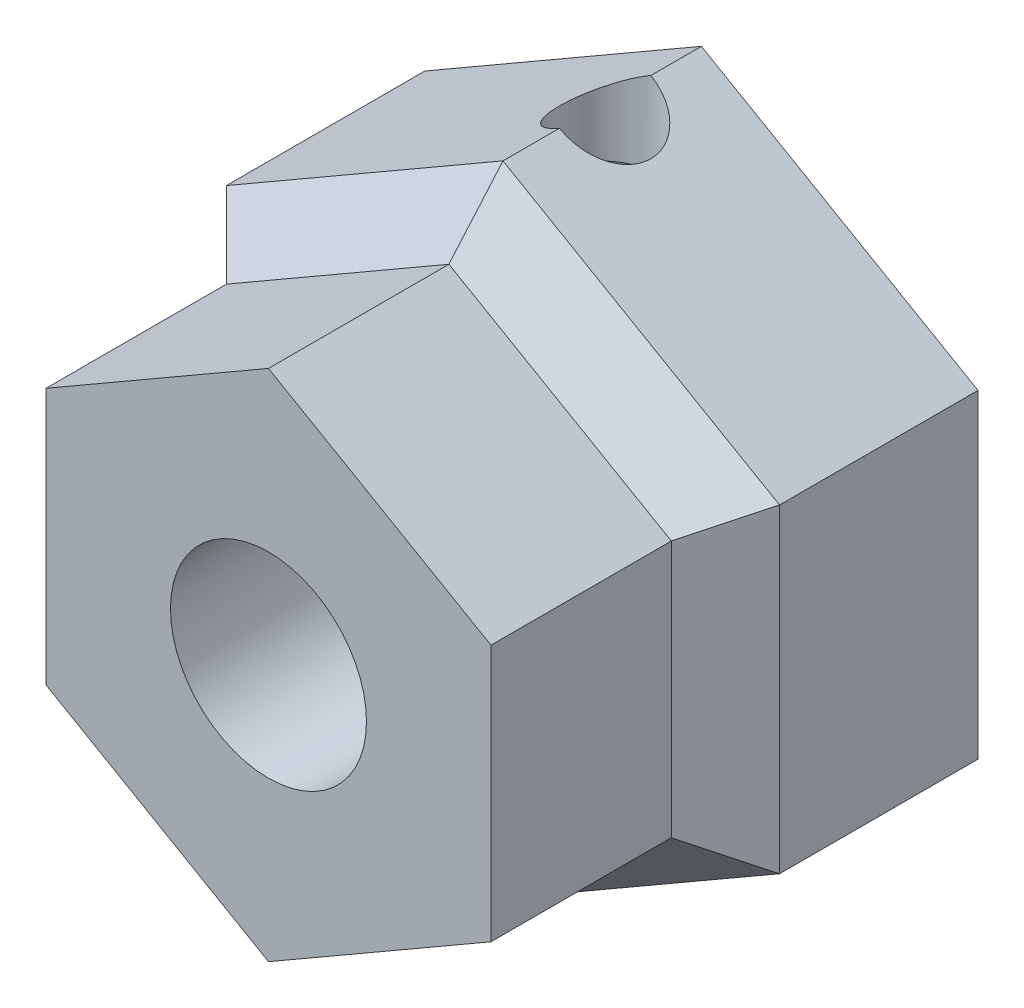
from build123d import *
from build123d.topology import SkipClean

# Parameters (mm, degrees)
SKETCH2_R           = 4.075
BOSS_EXTRUDE2_DEPTH = 8
SKETCH18_R          = 4.075
BOSS_EXTRUDE4_DEPTH = 10
SKETCH5_R           = 1.9
CUT_EXTRUDE8_DEPTH  = 26.151209381
CUT_EXTRUDE7_DEPTH  = 2.8
CIRPATTERN1_COUNT   = 2
CIRPATTERN1_ANGLE   = 90
BOSS_EXTRUDE3_START = 2.5
SKETCH17_R          = 5.575
SKETCH17_R_2        = 4.075
BOSS_EXTRUDE3_DEPTH = 2.5
CHAMFER4_SIZE       = 2.5


with BuildPart() as part:
    # Sketch2 → Boss-Extrude2 (new body)
    with BuildSketch(Plane.XY):
        Polygon((11.5, -6.639528096), (11.5, 6.639528096), (0, 13.279056191), (-11.5, 6.639528096), (-11.5, -6.639528096), (0, -13.279056191), align=None)
        Circle(SKETCH2_R, mode=Mode.SUBTRACT)
    extrude(amount=BOSS_EXTRUDE2_DEPTH)

    # Sketch18 → Boss-Extrude4 (add)
    with BuildSketch(Plane(origin=(0, 0, 8), x_dir=(-1, 0, 0), z_dir=(0, 0, -1))):
        Polygon((-9.25, -5.34048999), (0, -10.68097998), (9.25, -5.34048999), (9.25, 5.34048999), (0, 10.68097998), (-9.25, 5.34048999), align=None)
        with Locations(Location((0, 0, 0), (0, 0, 180))):
            Circle(SKETCH18_R, mode=Mode.SUBTRACT)
    extrude(amount=-BOSS_EXTRUDE4_DEPTH)

    # Sketch5 → Cut-Extrude8 (cut, through all)
    with BuildSketch(Plane(origin=(0, 0, 0), x_dir=(0, 0, -1), z_dir=(0, -1, 0))):
        with Locations((-4, 0)):
            Circle(SKETCH5_R)
    cut_extrude8 = extrude(amount=-CUT_EXTRUDE8_DEPTH, mode=Mode.SUBTRACT)

    # Sketch16 → Cut-Extrude7 (cut)
    with BuildSketch(Plane(origin=(0, 7, 0), x_dir=(1, 0, 0), z_dir=(0, 1, 0))):
        Polygon((0, -7.290896534), (2.85, -5.645448267), (2.85, -2.354551733), (2.85, 0), (-2.85, 0), (-2.85, -2.354551733), (-2.85, -5.645448267), align=None)
    cut_extrude7 = extrude(amount=CUT_EXTRUDE7_DEPTH, mode=Mode.SUBTRACT)

    # CirPattern1: Cut-Extrude8, Cut-Extrude7 ×2 about axis
    cirpattern1_axis = Axis((0, 0, 0), (0, 0, 1))
    add([cut_extrude8.rotate(cirpattern1_axis, i * CIRPATTERN1_ANGLE / (CIRPATTERN1_COUNT - 1)) for i in range(1, CIRPATTERN1_COUNT)], mode=Mode.SUBTRACT)
    add([cut_extrude7.rotate(cirpattern1_axis, i * CIRPATTERN1_ANGLE / (CIRPATTERN1_COUNT - 1)) for i in range(1, CIRPATTERN1_COUNT)], mode=Mode.SUBTRACT)

    # Sketch17 → Boss-Extrude3 (add)
    with SkipClean():  # the faces are left unmerged after this step: merging them gives an invalid solid
        with BuildSketch(Plane(origin=(0, 0, 0), x_dir=(-1, 0, 0), z_dir=(0, 0, -1)).offset(BOSS_EXTRUDE3_START)):
            with Locations(Location((0, 0, 0), (0, 0, 180))):
                Circle(SKETCH17_R)
            Circle(SKETCH17_R_2, mode=Mode.SUBTRACT)
        extrude(amount=-BOSS_EXTRUDE3_DEPTH)

    # Chamfer4
    # the kernel refuses this chamfer: 2.5 mm, written as the material it adds along each edge
    with BuildSketch(Plane(origin=(14.817856995, -2.125886255, 8), x_dir=(0.49981095845564855, -0.8656979742248802, -0.0274958766105863), z_dir=(-0.8660254037844386, -0.5000000000000002, 0))) as chamfer4_piece_1_section:
        Polygon((CHAMFER4_SIZE * 0.999621916911, CHAMFER4_SIZE * 0.0274958766106), (-CHAMFER4_SIZE * 0.0274958766106, CHAMFER4_SIZE * 0.999621916911), (0, 0), align=None)
    chamfer4_piece_1 = extrude(amount=23.53939492, mode=Mode.PRIVATE)
    chamfer4_piece_1 = split(chamfer4_piece_1, bisect_by=Plane(origin=(5.75, -9.959292144, 8.862467682), z_dir=(-0.5000000000000001, 0.8660254037844386, 0)), keep=Keep.TOP, mode=Mode.PRIVATE)
    chamfer4_piece_1 = split(chamfer4_piece_1, bisect_by=Plane(origin=(9.25, -8.662876539, 8.862467682), z_dir=(-1, 0, 0)), keep=Keep.TOP, mode=Mode.PRIVATE)
    chamfer4_piece_1 = split(chamfer4_piece_1, bisect_by=Plane(origin=(2.877271152, -12.342173254, 8.862467682), z_dir=(0.5000000000000001, 0.8660254037844387, 0)), keep=Keep.TOP, mode=Mode.PRIVATE)
    add(chamfer4_piece_1)
    with BuildSketch(Plane(origin=(5.567856995, -13.895583715, 8), x_dir=(-0.4998109584556484, -0.8656979742248803, -0.027495876610586313), z_dir=(-0.8660254037844387, 0.5000000000000001, 0))) as chamfer4_piece_2_section:
        Polygon((CHAMFER4_SIZE * 0.999621916911, CHAMFER4_SIZE * 0.0274958766106), (-CHAMFER4_SIZE * 0.0274958766106, CHAMFER4_SIZE * 0.999621916911), (0, 0), align=None)
    chamfer4_piece_2 = extrude(amount=23.53939492, mode=Mode.PRIVATE)
    chamfer4_piece_2 = split(chamfer4_piece_2, bisect_by=Plane(origin=(-5.75, -9.959292144, 8.862467682), z_dir=(0.5000000000000002, 0.8660254037844386, 0)), keep=Keep.TOP, mode=Mode.PRIVATE)
    chamfer4_piece_2 = split(chamfer4_piece_2, bisect_by=Plane(origin=(-9.25, -8.662876539, 8.862467682), z_dir=(1, 0, 0)), keep=Keep.TOP, mode=Mode.PRIVATE)
    chamfer4_piece_2 = split(chamfer4_piece_2, bisect_by=Plane(origin=(-2.877271152, -12.342173254, 8.862467682), z_dir=(-0.5000000000000002, 0.8660254037844386, 0)), keep=Keep.TOP, mode=Mode.PRIVATE)
    add(chamfer4_piece_2)
    with BuildSketch(Plane(origin=(-9.25, -11.76969746, 8), x_dir=(-0.9996219169112968, 0, -0.027495876610586317), z_dir=(0, 1, 0))) as chamfer4_piece_3_section:
        Polygon((CHAMFER4_SIZE * 0.999621916911, CHAMFER4_SIZE * 0.0274958766106), (-CHAMFER4_SIZE * 0.0274958766106, CHAMFER4_SIZE * 0.999621916911), (0, 0), align=None)
    chamfer4_piece_3 = extrude(amount=23.53939492, mode=Mode.PRIVATE)
    chamfer4_piece_3 = split(chamfer4_piece_3, bisect_by=Plane(origin=(-11.5, 0, 8.862467682), z_dir=(1, 0, 0)), keep=Keep.TOP, mode=Mode.PRIVATE)
    chamfer4_piece_3 = split(chamfer4_piece_3, bisect_by=Plane(origin=(-12.127271152, 3.679296716, 8.862467682), z_dir=(0.5, -0.8660254037844387, 0)), keep=Keep.TOP, mode=Mode.PRIVATE)
    chamfer4_piece_3 = split(chamfer4_piece_3, bisect_by=Plane(origin=(-12.127271152, -3.679296716, 8.862467682), z_dir=(0.5000000000000001, 0.8660254037844387, 0)), keep=Keep.TOP, mode=Mode.PRIVATE)
    add(chamfer4_piece_3)
    with BuildSketch(Plane(origin=(-14.817856995, 2.125886255, 8), x_dir=(-0.49981095845564827, 0.8656979742248804, -0.027495876610586303), z_dir=(0.8660254037844387, 0.5, 0))) as chamfer4_piece_4_section:
        Polygon((CHAMFER4_SIZE * 0.999621916911, CHAMFER4_SIZE * 0.0274958766106), (-CHAMFER4_SIZE * 0.0274958766106, CHAMFER4_SIZE * 0.999621916911), (0, 0), align=None)
    chamfer4_piece_4 = extrude(amount=23.53939492, mode=Mode.PRIVATE)
    chamfer4_piece_4 = split(chamfer4_piece_4, bisect_by=Plane(origin=(-5.75, 9.959292144, 8.862467682), z_dir=(0.49999999999999983, -0.8660254037844388, 0)), keep=Keep.TOP, mode=Mode.PRIVATE)
    chamfer4_piece_4 = split(chamfer4_piece_4, bisect_by=Plane(origin=(-2.877271152, 12.342173254, 8.862467682), z_dir=(-0.5, -0.8660254037844387, 0)), keep=Keep.TOP, mode=Mode.PRIVATE)
    chamfer4_piece_4 = split(chamfer4_piece_4, bisect_by=Plane(origin=(-9.25, 8.662876539, 8.862467682), z_dir=(1, 0, 0)), keep=Keep.TOP, mode=Mode.PRIVATE)
    add(chamfer4_piece_4)
    with BuildSketch(Plane(origin=(-5.567856995, 13.895583715, 8), x_dir=(0.4998109584556484, 0.8656979742248804, -0.027495876610586317), z_dir=(0.8660254037844387, -0.5, 0))) as chamfer4_piece_5_section:
        Polygon((CHAMFER4_SIZE * 0.999621916911, CHAMFER4_SIZE * 0.0274958766106), (-CHAMFER4_SIZE * 0.0274958766106, CHAMFER4_SIZE * 0.999621916911), (0, 0), align=None)
    chamfer4_piece_5 = extrude(amount=23.53939492, mode=Mode.PRIVATE)
    chamfer4_piece_5 = split(chamfer4_piece_5, bisect_by=Plane(origin=(5.75, 9.959292144, 8.862467682), z_dir=(-0.49999999999999983, -0.8660254037844388, 0)), keep=Keep.TOP, mode=Mode.PRIVATE)
    chamfer4_piece_5 = split(chamfer4_piece_5, bisect_by=Plane(origin=(9.25, 8.662876539, 8.862467682), z_dir=(-1, 0, 0)), keep=Keep.TOP, mode=Mode.PRIVATE)
    chamfer4_piece_5 = split(chamfer4_piece_5, bisect_by=Plane(origin=(2.877271152, 12.342173254, 8.862467682), z_dir=(0.5, -0.8660254037844387, 0)), keep=Keep.TOP, mode=Mode.PRIVATE)
    add(chamfer4_piece_5)
    with BuildSketch(Plane(origin=(9.25, 11.76969746, 8), x_dir=(0.9996219169112968, 0, -0.027495876610586317), z_dir=(0, -1, 0))) as chamfer4_piece_6_section:
        Polygon((CHAMFER4_SIZE * 0.999621916911, CHAMFER4_SIZE * 0.0274958766106), (-CHAMFER4_SIZE * 0.0274958766106, CHAMFER4_SIZE * 0.999621916911), (0, 0), align=None)
    chamfer4_piece_6 = extrude(amount=23.53939492, mode=Mode.PRIVATE)
    chamfer4_piece_6 = split(chamfer4_piece_6, bisect_by=Plane(origin=(11.5, 0, 8.862467682), z_dir=(-1, 0, 0)), keep=Keep.TOP, mode=Mode.PRIVATE)
    chamfer4_piece_6 = split(chamfer4_piece_6, bisect_by=Plane(origin=(12.127271152, 3.679296716, 8.862467682), z_dir=(-0.5, -0.8660254037844387, 0)), keep=Keep.TOP, mode=Mode.PRIVATE)
    chamfer4_piece_6 = split(chamfer4_piece_6, bisect_by=Plane(origin=(12.127271152, -3.679296716, 8.862467682), z_dir=(-0.5000000000000002, 0.8660254037844386, 0)), keep=Keep.TOP, mode=Mode.PRIVATE)
    add(chamfer4_piece_6)
    with BuildSketch(Plane(origin=(9.25, 11.76969746, 8), x_dir=(0.9996219169112968, 0, -0.027495876610586317), z_dir=(0, -1, 0))) as chamfer4_piece_7a_section:
        Polygon((CHAMFER4_SIZE * 0.999621916911, CHAMFER4_SIZE * 0.0274958766106), (-CHAMFER4_SIZE * 0.0274958766106, CHAMFER4_SIZE * 0.999621916911), (0, 0), align=None)
    chamfer4_piece_7a = extrude(amount=23.53939492, mode=Mode.PRIVATE)
    chamfer4_piece_7a = split(chamfer4_piece_7a, bisect_by=Plane(origin=(11.5, -6.180288519, 8.839751868), z_dir=(-1, 0, 0)), keep=Keep.TOP, mode=Mode.PRIVATE)
    chamfer4_piece_7a = split(chamfer4_piece_7a, bisect_by=Plane(origin=(10.60792628, -7.154567098, 8.839751868), z_dir=(-0.5000000000000001, 0.8660254037844386, 0)), keep=Keep.TOP, mode=Mode.PRIVATE)
    chamfer4_piece_7a = split(chamfer4_piece_7a, bisect_by=Plane(origin=(9.48292628, -5.20600994, 8.839751868), z_dir=(0.5000000000000002, -0.8660254037844386, 0)), keep=Keep.TOP, mode=Mode.PRIVATE)
    with BuildSketch(Plane(origin=(14.817856995, -2.125886255, 8), x_dir=(0.49981095845564855, -0.8656979742248802, -0.0274958766105863), z_dir=(-0.8660254037844386, -0.5000000000000002, 0))) as chamfer4_piece_7b_section:
        Polygon((CHAMFER4_SIZE * 0.999621916911, CHAMFER4_SIZE * 0.0274958766106), (-CHAMFER4_SIZE * 0.0274958766106, CHAMFER4_SIZE * 0.999621916911), (0, 0), align=None)
    chamfer4_piece_7b = extrude(amount=23.53939492, mode=Mode.PRIVATE)
    chamfer4_piece_7b = split(chamfer4_piece_7b, bisect_by=Plane(origin=(11.5, -5.609450091, 8.839751868), z_dir=(-1, 0, 0)), keep=Keep.TOP, mode=Mode.PRIVATE)
    chamfer4_piece_7b = split(chamfer4_piece_7b, bisect_by=Plane(origin=(11.10228686, -6.869147884, 8.839751868), z_dir=(-0.5000000000000001, 0.8660254037844386, 0)), keep=Keep.TOP, mode=Mode.PRIVATE)
    chamfer4_piece_7b = split(chamfer4_piece_7b, bisect_by=Plane(origin=(9.25, -5.609450091, 8.839751868), z_dir=(1, 0, 0)), keep=Keep.TOP, mode=Mode.PRIVATE)
    chamfer4_piece_7 = chamfer4_piece_7a & chamfer4_piece_7b
    add(chamfer4_piece_7)
    with BuildSketch(Plane(origin=(5.567856995, -13.895583715, 8), x_dir=(-0.4998109584556484, -0.8656979742248803, -0.027495876610586313), z_dir=(-0.8660254037844387, 0.5000000000000001, 0))) as chamfer4_piece_8a_section:
        Polygon((CHAMFER4_SIZE * 0.999621916911, CHAMFER4_SIZE * 0.0274958766106), (-CHAMFER4_SIZE * 0.0274958766106, CHAMFER4_SIZE * 0.999621916911), (0, 0), align=None)
    chamfer4_piece_8a = extrude(amount=23.53939492, mode=Mode.PRIVATE)
    chamfer4_piece_8a = split(chamfer4_piece_8a, bisect_by=Plane(origin=(0.89207372, -12.764017189, 8.839751868), z_dir=(-0.5000000000000001, 0.8660254037844386, 0)), keep=Keep.TOP, mode=Mode.PRIVATE)
    chamfer4_piece_8a = split(chamfer4_piece_8a, bisect_by=Plane(origin=(-0.39771314, -13.049436403, 8.839751868), z_dir=(0.5000000000000002, 0.8660254037844386, 0)), keep=Keep.TOP, mode=Mode.PRIVATE)
    chamfer4_piece_8a = split(chamfer4_piece_8a, bisect_by=Plane(origin=(-0.23292628, -10.81546003, 8.839751868), z_dir=(0.5000000000000002, -0.8660254037844386, 0)), keep=Keep.TOP, mode=Mode.PRIVATE)
    with BuildSketch(Plane(origin=(14.817856995, -2.125886255, 8), x_dir=(0.49981095845564855, -0.8656979742248802, -0.0274958766105863), z_dir=(-0.8660254037844386, -0.5000000000000002, 0))) as chamfer4_piece_8b_section:
        Polygon((CHAMFER4_SIZE * 0.999621916911, CHAMFER4_SIZE * 0.0274958766106), (-CHAMFER4_SIZE * 0.0274958766106, CHAMFER4_SIZE * 0.999621916911), (0, 0), align=None)
    chamfer4_piece_8b = extrude(amount=23.53939492, mode=Mode.PRIVATE)
    chamfer4_piece_8b = split(chamfer4_piece_8b, bisect_by=Plane(origin=(0.39771314, -13.049436403, 8.839751868), z_dir=(-0.5000000000000001, 0.8660254037844386, 0)), keep=Keep.TOP, mode=Mode.PRIVATE)
    chamfer4_piece_8b = split(chamfer4_piece_8b, bisect_by=Plane(origin=(-0.89207372, -12.764017189, 8.839751868), z_dir=(0.5000000000000002, 0.8660254037844386, 0)), keep=Keep.TOP, mode=Mode.PRIVATE)
    chamfer4_piece_8b = split(chamfer4_piece_8b, bisect_by=Plane(origin=(0.23292628, -10.81546003, 8.839751868), z_dir=(-0.5000000000000001, -0.8660254037844387, 0)), keep=Keep.TOP, mode=Mode.PRIVATE)
    chamfer4_piece_8 = chamfer4_piece_8a & chamfer4_piece_8b
    add(chamfer4_piece_8)
    with BuildSketch(Plane(origin=(-9.25, -11.76969746, 8), x_dir=(-0.9996219169112968, 0, -0.027495876610586317), z_dir=(0, 1, 0))) as chamfer4_piece_9a_section:
        Polygon((CHAMFER4_SIZE * 0.999621916911, CHAMFER4_SIZE * 0.0274958766106), (-CHAMFER4_SIZE * 0.0274958766106, CHAMFER4_SIZE * 0.999621916911), (0, 0), align=None)
    chamfer4_piece_9a = extrude(amount=23.53939492, mode=Mode.PRIVATE)
    chamfer4_piece_9a = split(chamfer4_piece_9a, bisect_by=Plane(origin=(-10.60792628, -7.154567098, 8.839751868), z_dir=(0.5000000000000002, 0.8660254037844386, 0)), keep=Keep.TOP, mode=Mode.PRIVATE)
    chamfer4_piece_9a = split(chamfer4_piece_9a, bisect_by=Plane(origin=(-11.5, -6.180288519, 8.839751868), z_dir=(1, 0, 0)), keep=Keep.TOP, mode=Mode.PRIVATE)
    chamfer4_piece_9a = split(chamfer4_piece_9a, bisect_by=Plane(origin=(-9.48292628, -5.20600994, 8.839751868), z_dir=(-0.5000000000000001, -0.8660254037844387, 0)), keep=Keep.TOP, mode=Mode.PRIVATE)
    with BuildSketch(Plane(origin=(5.567856995, -13.895583715, 8), x_dir=(-0.4998109584556484, -0.8656979742248803, -0.027495876610586313), z_dir=(-0.8660254037844387, 0.5000000000000001, 0))) as chamfer4_piece_9b_section:
        Polygon((CHAMFER4_SIZE * 0.999621916911, CHAMFER4_SIZE * 0.0274958766106), (-CHAMFER4_SIZE * 0.0274958766106, CHAMFER4_SIZE * 0.999621916911), (0, 0), align=None)
    chamfer4_piece_9b = extrude(amount=23.53939492, mode=Mode.PRIVATE)
    chamfer4_piece_9b = split(chamfer4_piece_9b, bisect_by=Plane(origin=(-11.10228686, -6.869147884, 8.839751868), z_dir=(0.5000000000000002, 0.8660254037844386, 0)), keep=Keep.TOP, mode=Mode.PRIVATE)
    chamfer4_piece_9b = split(chamfer4_piece_9b, bisect_by=Plane(origin=(-11.5, -5.609450091, 8.839751868), z_dir=(1, 0, 0)), keep=Keep.TOP, mode=Mode.PRIVATE)
    chamfer4_piece_9b = split(chamfer4_piece_9b, bisect_by=Plane(origin=(-9.25, -5.609450091, 8.839751868), z_dir=(-1, 0, 0)), keep=Keep.TOP, mode=Mode.PRIVATE)
    chamfer4_piece_9 = chamfer4_piece_9a & chamfer4_piece_9b
    add(chamfer4_piece_9)
    with BuildSketch(Plane(origin=(-14.817856995, 2.125886255, 8), x_dir=(-0.49981095845564827, 0.8656979742248804, -0.027495876610586303), z_dir=(0.8660254037844387, 0.5, 0))) as chamfer4_piece_10a_section:
        Polygon((CHAMFER4_SIZE * 0.999621916911, CHAMFER4_SIZE * 0.0274958766106), (-CHAMFER4_SIZE * 0.0274958766106, CHAMFER4_SIZE * 0.999621916911), (0, 0), align=None)
    chamfer4_piece_10a = extrude(amount=23.53939492, mode=Mode.PRIVATE)
    chamfer4_piece_10a = split(chamfer4_piece_10a, bisect_by=Plane(origin=(-11.10228686, 6.869147884, 8.839751868), z_dir=(0.49999999999999983, -0.8660254037844388, 0)), keep=Keep.TOP, mode=Mode.PRIVATE)
    chamfer4_piece_10a = split(chamfer4_piece_10a, bisect_by=Plane(origin=(-11.5, 5.609450091, 8.839751868), z_dir=(1, 0, 0)), keep=Keep.TOP, mode=Mode.PRIVATE)
    chamfer4_piece_10a = split(chamfer4_piece_10a, bisect_by=Plane(origin=(-9.25, 5.609450091, 8.839751868), z_dir=(-1, 0, 0)), keep=Keep.TOP, mode=Mode.PRIVATE)
    with BuildSketch(Plane(origin=(-9.25, -11.76969746, 8), x_dir=(-0.9996219169112968, 0, -0.027495876610586317), z_dir=(0, 1, 0))) as chamfer4_piece_10b_section:
        Polygon((CHAMFER4_SIZE * 0.999621916911, CHAMFER4_SIZE * 0.0274958766106), (-CHAMFER4_SIZE * 0.0274958766106, CHAMFER4_SIZE * 0.999621916911), (0, 0), align=None)
    chamfer4_piece_10b = extrude(amount=23.53939492, mode=Mode.PRIVATE)
    chamfer4_piece_10b = split(chamfer4_piece_10b, bisect_by=Plane(origin=(-10.60792628, 7.154567098, 8.839751868), z_dir=(0.49999999999999983, -0.8660254037844388, 0)), keep=Keep.TOP, mode=Mode.PRIVATE)
    chamfer4_piece_10b = split(chamfer4_piece_10b, bisect_by=Plane(origin=(-11.5, 6.180288519, 8.839751868), z_dir=(1, 0, 0)), keep=Keep.TOP, mode=Mode.PRIVATE)
    chamfer4_piece_10b = split(chamfer4_piece_10b, bisect_by=Plane(origin=(-9.48292628, 5.20600994, 8.839751868), z_dir=(-0.5, 0.8660254037844387, 0)), keep=Keep.TOP, mode=Mode.PRIVATE)
    chamfer4_piece_10 = chamfer4_piece_10a & chamfer4_piece_10b
    add(chamfer4_piece_10)
    with BuildSketch(Plane(origin=(-5.567856995, 13.895583715, 8), x_dir=(0.4998109584556484, 0.8656979742248804, -0.027495876610586317), z_dir=(0.8660254037844387, -0.5, 0))) as chamfer4_piece_11a_section:
        Polygon((CHAMFER4_SIZE * 0.999621916911, CHAMFER4_SIZE * 0.0274958766106), (-CHAMFER4_SIZE * 0.0274958766106, CHAMFER4_SIZE * 0.999621916911), (0, 0), align=None)
    chamfer4_piece_11a = extrude(amount=23.53939492, mode=Mode.PRIVATE)
    chamfer4_piece_11a = split(chamfer4_piece_11a, bisect_by=Plane(origin=(0.39771314, 13.049436403, 8.839751868), z_dir=(-0.49999999999999983, -0.8660254037844388, 0)), keep=Keep.TOP, mode=Mode.PRIVATE)
    chamfer4_piece_11a = split(chamfer4_piece_11a, bisect_by=Plane(origin=(-0.89207372, 12.764017189, 8.839751868), z_dir=(0.49999999999999983, -0.8660254037844388, 0)), keep=Keep.TOP, mode=Mode.PRIVATE)
    chamfer4_piece_11a = split(chamfer4_piece_11a, bisect_by=Plane(origin=(0.23292628, 10.81546003, 8.839751868), z_dir=(-0.5, 0.8660254037844387, 0)), keep=Keep.TOP, mode=Mode.PRIVATE)
    with BuildSketch(Plane(origin=(-14.817856995, 2.125886255, 8), x_dir=(-0.49981095845564827, 0.8656979742248804, -0.027495876610586303), z_dir=(0.8660254037844387, 0.5, 0))) as chamfer4_piece_11b_section:
        Polygon((CHAMFER4_SIZE * 0.999621916911, CHAMFER4_SIZE * 0.0274958766106), (-CHAMFER4_SIZE * 0.0274958766106, CHAMFER4_SIZE * 0.999621916911), (0, 0), align=None)
    chamfer4_piece_11b = extrude(amount=23.53939492, mode=Mode.PRIVATE)
    chamfer4_piece_11b = split(chamfer4_piece_11b, bisect_by=Plane(origin=(0.89207372, 12.764017189, 8.839751868), z_dir=(-0.49999999999999983, -0.8660254037844388, 0)), keep=Keep.TOP, mode=Mode.PRIVATE)
    chamfer4_piece_11b = split(chamfer4_piece_11b, bisect_by=Plane(origin=(-0.39771314, 13.049436403, 8.839751868), z_dir=(0.49999999999999983, -0.8660254037844388, 0)), keep=Keep.TOP, mode=Mode.PRIVATE)
    chamfer4_piece_11b = split(chamfer4_piece_11b, bisect_by=Plane(origin=(-0.23292628, 10.81546003, 8.839751868), z_dir=(0.5, 0.8660254037844387, 0)), keep=Keep.TOP, mode=Mode.PRIVATE)
    chamfer4_piece_11 = chamfer4_piece_11a & chamfer4_piece_11b
    add(chamfer4_piece_11)
    with BuildSketch(Plane(origin=(9.25, 11.76969746, 8), x_dir=(0.9996219169112968, 0, -0.027495876610586317), z_dir=(0, -1, 0))) as chamfer4_piece_12a_section:
        Polygon((CHAMFER4_SIZE * 0.999621916911, CHAMFER4_SIZE * 0.0274958766106), (-CHAMFER4_SIZE * 0.0274958766106, CHAMFER4_SIZE * 0.999621916911), (0, 0), align=None)
    chamfer4_piece_12a = extrude(amount=23.53939492, mode=Mode.PRIVATE)
    chamfer4_piece_12a = split(chamfer4_piece_12a, bisect_by=Plane(origin=(11.5, 6.180288519, 8.839751868), z_dir=(-1, 0, 0)), keep=Keep.TOP, mode=Mode.PRIVATE)
    chamfer4_piece_12a = split(chamfer4_piece_12a, bisect_by=Plane(origin=(10.60792628, 7.154567098, 8.839751868), z_dir=(-0.49999999999999983, -0.8660254037844388, 0)), keep=Keep.TOP, mode=Mode.PRIVATE)
    chamfer4_piece_12a = split(chamfer4_piece_12a, bisect_by=Plane(origin=(9.48292628, 5.20600994, 8.839751868), z_dir=(0.5, 0.8660254037844387, 0)), keep=Keep.TOP, mode=Mode.PRIVATE)
    with BuildSketch(Plane(origin=(-5.567856995, 13.895583715, 8), x_dir=(0.4998109584556484, 0.8656979742248804, -0.027495876610586317), z_dir=(0.8660254037844387, -0.5, 0))) as chamfer4_piece_12b_section:
        Polygon((CHAMFER4_SIZE * 0.999621916911, CHAMFER4_SIZE * 0.0274958766106), (-CHAMFER4_SIZE * 0.0274958766106, CHAMFER4_SIZE * 0.999621916911), (0, 0), align=None)
    chamfer4_piece_12b = extrude(amount=23.53939492, mode=Mode.PRIVATE)
    chamfer4_piece_12b = split(chamfer4_piece_12b, bisect_by=Plane(origin=(11.5, 5.609450091, 8.839751868), z_dir=(-1, 0, 0)), keep=Keep.TOP, mode=Mode.PRIVATE)
    chamfer4_piece_12b = split(chamfer4_piece_12b, bisect_by=Plane(origin=(11.10228686, 6.869147884, 8.839751868), z_dir=(-0.49999999999999983, -0.8660254037844388, 0)), keep=Keep.TOP, mode=Mode.PRIVATE)
    chamfer4_piece_12b = split(chamfer4_piece_12b, bisect_by=Plane(origin=(9.25, 5.609450091, 8.839751868), z_dir=(1, 0, 0)), keep=Keep.TOP, mode=Mode.PRIVATE)
    chamfer4_piece_12 = chamfer4_piece_12a & chamfer4_piece_12b
    add(chamfer4_piece_12)


solid = part.part
